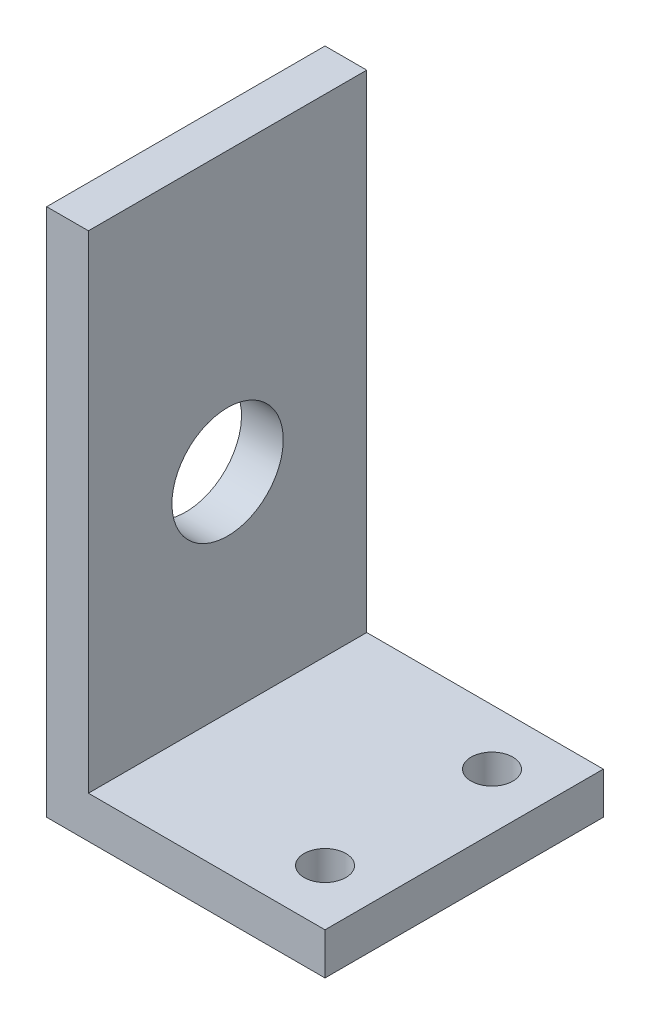
from build123d import *

# Parameters (mm, degrees)
EXTRUDE_1_DEPTH     = 20
SKETCH_2_R          = 1.5
CUT_EXTRUDE_1_DEPTH = 46
SKETCH_3_R          = 4
CUT_EXTRUDE_2_DEPTH = 47.184412955


with BuildPart() as part:
    # 草图1 → 凸台-拉伸1 (new body)
    with BuildSketch(Plane.XY):
        Polygon((0, 0), (0, 38), (3, 38), (3, 3), (20, 3), (20, 0), align=None)
    extrude(amount=EXTRUDE_1_DEPTH)

    # 草图2 → 切除-拉伸1 (cut, through all)
    with BuildSketch(Plane(origin=(0, 3, 0), x_dir=(1, 0, 0), z_dir=(0, 1, 0))):
        with Locations((16, -16)):
            Circle(SKETCH_2_R)
        with Locations((16, -4)):
            Circle(SKETCH_2_R)
    extrude(amount=-CUT_EXTRUDE_1_DEPTH, mode=Mode.SUBTRACT)

    # 草图3 → 切除-拉伸2 (cut, through all)
    with BuildSketch(Plane(origin=(3, 0, 0), x_dir=(0, 0, -1), z_dir=(1, 0, 0))):
        with Locations((-10, 18)):
            Circle(SKETCH_3_R)
    extrude(amount=-CUT_EXTRUDE_2_DEPTH, mode=Mode.SUBTRACT)


solid = part.part
